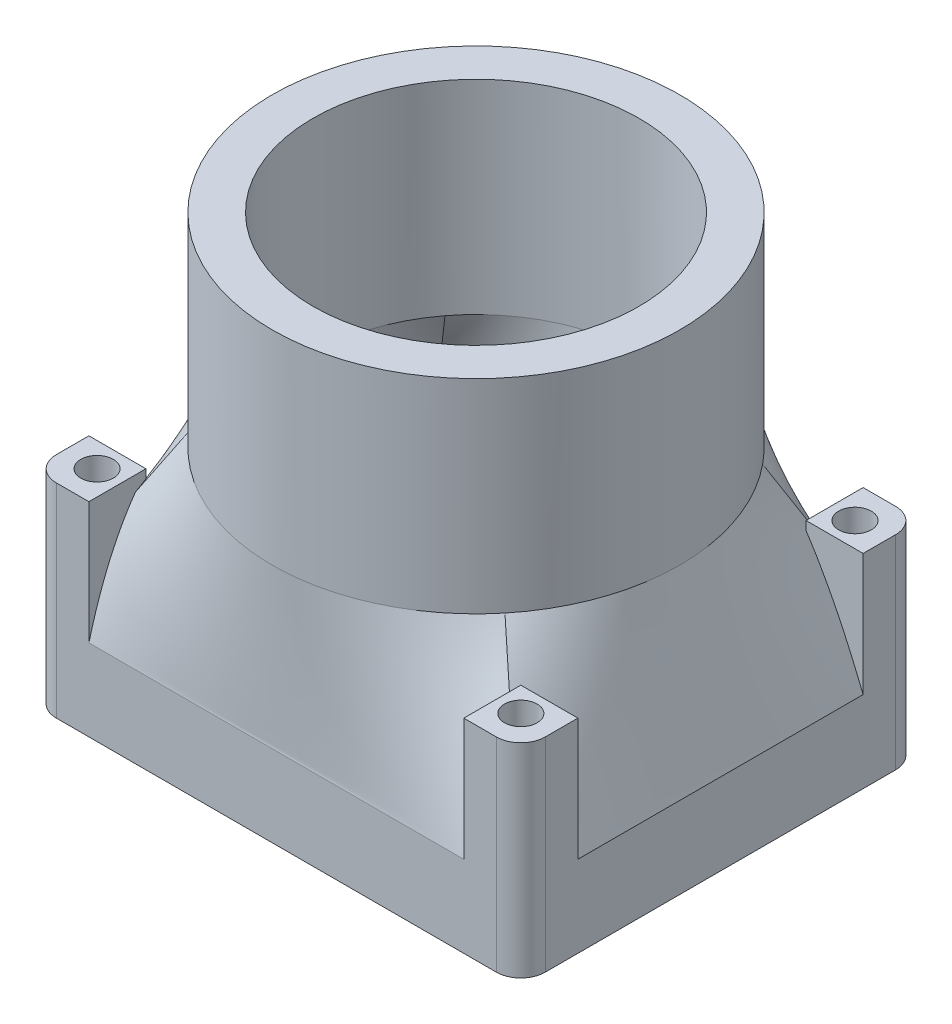
from build123d import *

# Parameters (mm, degrees)
SKETCH1_W           = 60
SKETCH1_H           = 49
SKETCH1_R           = 2
SKETCH1_W_2         = 46
SKETCH1_H_2         = 35
BOSS_EXTRUDE1_DEPTH = 10
SKETCH6_R           = 2
CUT_EXTRUDE3_DEPTH  = 50.244289182
SKETCH7_W           = 7
SKETCH7_H           = 7
SKETCH7_R           = 2
BOSS_EXTRUDE4_DEPTH = 25
SKETCH10_R          = 25
SKETCH10_R_2        = 20
BOSS_EXTRUDE5_DEPTH = 25
FILLET2_R           = 3


with BuildPart() as part:
    # Sketch1 → Boss-Extrude1 (new body)
    with BuildSketch(Plane(origin=(0, 0, 0), x_dir=(1, 0, 0), z_dir=(0, 1, 0))):
        Rectangle(SKETCH1_W, SKETCH1_H)
        with Locations((-26, 20.5)):
            Circle(SKETCH1_R, mode=Mode.SUBTRACT)
        with Locations((26, 20.5)):
            Circle(SKETCH1_R, mode=Mode.SUBTRACT)
        with Locations((26, -20.5)):
            Circle(SKETCH1_R, mode=Mode.SUBTRACT)
        with Locations((-26, -20.5)):
            Circle(SKETCH1_R, mode=Mode.SUBTRACT)
        Rectangle(SKETCH1_W_2, SKETCH1_H_2, mode=Mode.SUBTRACT)
    extrude(amount=BOSS_EXTRUDE1_DEPTH)

    # Sketch9 → Loft1 section 0
    with BuildSketch(Plane(origin=(0, 10, 0), x_dir=(1, 0, 0), z_dir=(0, 1, 0))):
        with BuildLine():
            Line((30, -24.5), (-30, -24.5))
            Line((-30, -24.5), (-30, 24.5))
            Line((-30, 24.5), (30, 24.5))
            Line((30, 24.5), (30, -24.5))
        make_face()
    # Sketch8 for Loft1 → Loft1 section 1
    with BuildSketch(Plane(origin=(0, 30, 0), x_dir=(1, 0, 0), z_dir=(0, 1, 0))):
        with BuildLine():
            # circular arc as an exact rational Bezier (weights 1, cos(half-angle), 1)
            Bezier((19.36330319, -15.813364272), (0, -39.523531441), (-19.36330319, -15.813364272), weights=[1, 0.632534571, 1])
            Bezier((-19.36330319, -15.813364272), (-32.277550677, 0), (-19.36330319, 15.813364272), weights=[1, 0.774532128, 1])
            Bezier((-19.36330319, 15.813364272), (0, 39.523531441), (19.36330319, 15.813364272), weights=[1, 0.632534571, 1])
            Bezier((19.36330319, 15.813364272), (32.277550677, 0), (19.36330319, -15.813364272), weights=[1, 0.774532128, 1])
        make_face()
    loft()

    # Sketch2 → Cut-Loft1 section 0
    with BuildSketch(Plane(origin=(0, 10, 0), x_dir=(1, 0, 0), z_dir=(0, 1, 0))):
        with BuildLine():
            Line((-23, -17.5), (23, -17.5))
            Line((23, -17.5), (23, 17.5))
            Line((23, 17.5), (-23, 17.5))
            Line((-23, 17.5), (-23, -17.5))
        make_face()
    # Sketch3 for Cut-Loft1 → Cut-Loft1 section 1
    with BuildSketch(Plane(origin=(0, 30, 0), x_dir=(1, 0, 0), z_dir=(0, 1, 0))):
        with BuildLine():
            Bezier((-15.916573882, -12.11043665), (0, -33.029362323), (15.916573882, -12.11043665), weights=[1, 0.605521832, 1])
            Bezier((15.916573882, -12.11043665), (25.131036551, 0), (15.916573882, 12.11043665), weights=[1, 0.795828694, 1])
            Bezier((15.916573882, 12.11043665), (0, 33.029362323), (-15.916573882, 12.11043665), weights=[1, 0.605521832, 1])
            Bezier((-15.916573882, 12.11043665), (-25.131036551, 0), (-15.916573882, -12.11043665), weights=[1, 0.795828694, 1])
        make_face()
    loft(mode=Mode.SUBTRACT)

    # Sketch6 → Cut-Extrude3 (cut, through all)
    with BuildSketch(Plane.XZ):
        with Locations((26, 20.5)):
            Circle(SKETCH6_R)
        with Locations((26, -20.5)):
            Circle(SKETCH6_R)
        with Locations((-26, -20.5)):
            Circle(SKETCH6_R)
        with Locations((-26, 20.5)):
            Circle(SKETCH6_R)
    extrude(amount=-CUT_EXTRUDE3_DEPTH, mode=Mode.SUBTRACT)

    # Sketch7 → Boss-Extrude4 (add)
    # profile 1 of 4: a face of its own
    with BuildSketch(Plane.XZ):
        with Locations((-26.5, 21)):
            Rectangle(SKETCH7_W, SKETCH7_H)
        with Locations((-26, 20.5)):
            Circle(SKETCH7_R, mode=Mode.SUBTRACT)
    # profile 2 of 4: a face of its own
    with BuildSketch(Plane.XZ):
        with Locations((-26.5, -21)):
            Rectangle(SKETCH7_W, SKETCH7_H)
        with Locations((-26, -20.5)):
            Circle(SKETCH7_R, mode=Mode.SUBTRACT)
    # profile 3 of 4: a face of its own
    with BuildSketch(Plane.XZ):
        with Locations((26.5, -21)):
            Rectangle(SKETCH7_W, SKETCH7_H)
        with Locations((26, -20.5)):
            Circle(SKETCH7_R, mode=Mode.SUBTRACT)
    # profile 4 of 4: a face of its own
    with BuildSketch(Plane.XZ):
        with Locations((26.5, 21)):
            Rectangle(SKETCH7_W, SKETCH7_H)
        with Locations((26, 20.5)):
            Circle(SKETCH7_R, mode=Mode.SUBTRACT)
    extrude(amount=-BOSS_EXTRUDE4_DEPTH)

    # Sketch10 → Boss-Extrude5 (add)
    with BuildSketch(Plane(origin=(0, 30, 0), x_dir=(1, 0, 0), z_dir=(0, 1, 0))):
        Circle(SKETCH10_R)
        Circle(SKETCH10_R_2, mode=Mode.SUBTRACT)
    extrude(amount=BOSS_EXTRUDE5_DEPTH)

    # Fillet2
    fillet2_edges = [part.edges().sort_by_distance(p)[0] for p in [
        (-30, 12.5, 24.5),
        (-30, 12.5, -24.5),
        (30, 12.5, -24.5),
        (30, 12.5, 24.5),
    ]]
    fillet(fillet2_edges, radius=FILLET2_R)


solid = part.part
